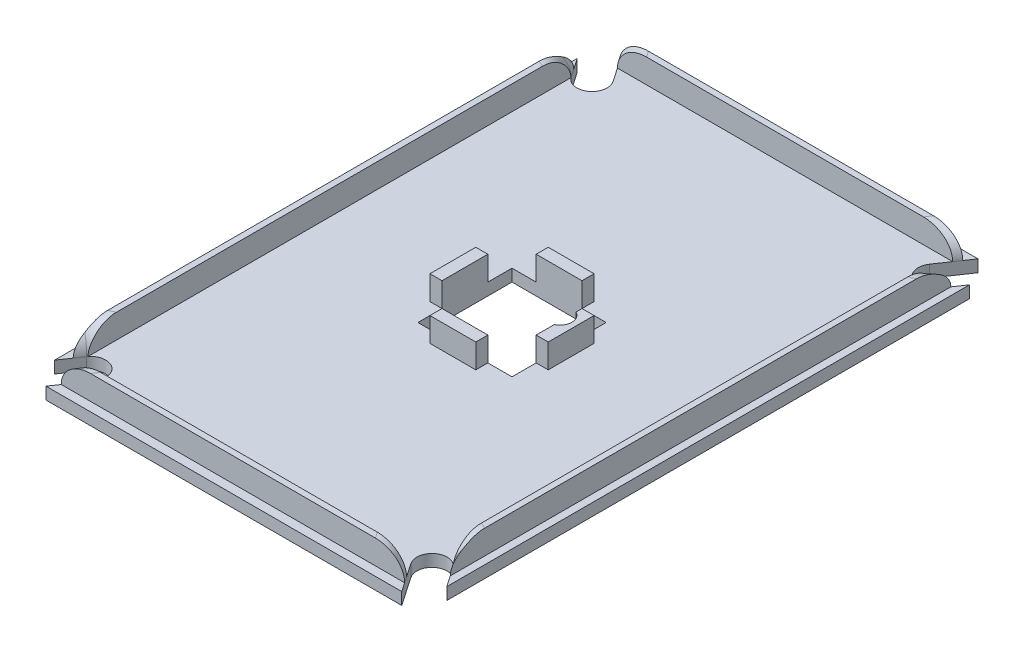
from build123d import *

# Parameters (mm, degrees)
SKETCH1_W           = 65
SKETCH1_H           = 95.5
BOSS_EXTRUDE1_DEPTH = 2
SKETCH1_3_W         = 62.5
SKETCH1_3_H         = 92.5
BOSS_EXTRUDE2_DEPTH = 6
SKETCH2_4_W         = 19.6
SKETCH2_4_H         = 19.6
BOSS_EXTRUDE3_DEPTH = 6
CUT_EXTRUDE2_DEPTH  = 39
CUT_EXTRUDE3_DEPTH  = 10
FILLET1_R           = 4
BOSS_EXTRUDE4_DEPTH = 1
SKETCH5_W           = 19.6
SKETCH5_H           = 19.6
CUT_EXTRUDE7_DEPTH  = 4
SKETCH8_W           = 6
SKETCH8_H           = 6
CUT_EXTRUDE8_DEPTH  = 10


with BuildPart() as part:
    # Sketch1 → Boss-Extrude1 (new body)
    with BuildSketch(Plane(origin=(0, 0, 0), x_dir=(1, 0, 0), z_dir=(0, 1, 0))):
        Rectangle(SKETCH1_W, SKETCH1_H)
    extrude(amount=BOSS_EXTRUDE1_DEPTH)

    # Sketch1<3> → Boss-Extrude2 (add)
    with BuildSketch(Plane(origin=(0, 0, 0), x_dir=(1, 0, 0), z_dir=(0, 1, 0))):
        Rectangle(SKETCH1_3_W, SKETCH1_3_H)
    extrude(amount=BOSS_EXTRUDE2_DEPTH)

    # Sketch2<4> → Boss-Extrude3 (add)
    with BuildSketch(Plane(origin=(0, 0, 0), x_dir=(1, 0, 0), z_dir=(0, 1, 0))):
        Rectangle(SKETCH2_4_W, SKETCH2_4_H)
    extrude(amount=BOSS_EXTRUDE3_DEPTH)

    # Sketch2 → Cut-Extrude2 (cut)
    with BuildSketch(Plane(origin=(0, 0, 0), x_dir=(1, 0, 0), z_dir=(0, 1, 0))):
        with BuildLine():
            Line((-7.8, 7.8), (-7.8, -7.8))
            Line((-7.8, -7.8), (7.8, -7.8))
            Line((7.8, -7.8), (7.8, -0.8))
            ThreePointArc((7.8, -0.8), (8.928220211, 1), (7.8, 2.8))
            Line((7.8, 2.8), (7.8, 7.8))
            Line((7.8, 7.8), (-7.8, 7.8))
        make_face()
    extrude(amount=CUT_EXTRUDE2_DEPTH, mode=Mode.SUBTRACT)

    # Sketch3 → Cut-Extrude3 (cut)
    with BuildSketch(Plane(origin=(0, 0, 0), x_dir=(1, 0, 0), z_dir=(0, 1, 0))):
        with BuildLine():
            Line((-30.433287704, 49.156662819), (-34.566712296, 46.343337181))
            Line((-34.566712296, 46.343337181), (-30.346723838, 40.143200294))
            ThreePointArc((-30.346723838, 40.143200294), (-26.873348724, 39.483150817), (-26.213299247, 42.956525932))
            Line((-26.213299247, 42.956525932), (-30.433287704, 49.156662819))
        make_face()
        with BuildLine():
            Line((34.566712296, 46.343337181), (30.433287704, 49.156662819))
            Line((30.433287704, 49.156662819), (26.213299247, 42.956525932))
            ThreePointArc((26.213299247, 42.956525932), (26.873348724, 39.483150817), (30.346723838, 40.143200294))
            Line((30.346723838, 40.143200294), (34.566712296, 46.343337181))
        make_face()
        with BuildLine():
            Line((-30.346723838, -40.143200294), (-34.566712296, -46.343337181))
            Line((-34.566712296, -46.343337181), (-30.433287704, -49.156662819))
            Line((-30.433287704, -49.156662819), (-26.213299247, -42.956525932))
            ThreePointArc((-26.213299247, -42.956525932), (-26.873348724, -39.483150817), (-30.346723838, -40.143200294))
        make_face()
        with BuildLine():
            Line((26.213299247, -42.956525932), (30.433287704, -49.156662819))
            Line((30.433287704, -49.156662819), (34.566712296, -46.343337181))
            Line((34.566712296, -46.343337181), (30.346723838, -40.143200294))
            ThreePointArc((30.346723838, -40.143200294), (26.873348724, -39.483150817), (26.213299247, -42.956525932))
        make_face()
    extrude(amount=CUT_EXTRUDE3_DEPTH, mode=Mode.SUBTRACT)

    # Fillet1
    # the kernel refuses this fillet: 4 mm, written as the material it takes off along each edge
    with BuildSketch(Plane(origin=(-36.876651276, 6, 49.737170606), x_dir=(0, -1, 0), z_dir=(0.5626651276372232, 0, -0.826684918297768)), Plane(origin=(30.346723838, 6, 40.143200294), x_dir=(0, -1, 0), z_dir=(0.5626651276372238, 0, 0.8266849182977677)), Plane(origin=(36.876651276, 6, -49.737170606), x_dir=(0, -1, 0), z_dir=(-0.562665127637224, 0, 0.8266849182977676)), Plane(origin=(-30.346723838, 6, -40.143200294), x_dir=(0, -1, 0), z_dir=(-0.5626651276372242, 0, -0.8266849182977674))) as fillet1_piece_1:
        with BuildLine():
            CenterArc((FILLET1_R, FILLET1_R), FILLET1_R, 180, 90)
            Line((0, FILLET1_R), (0, 0))
            Line((0, 0), (FILLET1_R, 0))
        make_face()
    extrude(amount=11.605353019, mode=Mode.SUBTRACT)
    with BuildSketch(Plane(origin=(-26.213299247, 6, 42.956525932), x_dir=(0, -1, 0), z_dir=(-0.5626651276372243, 0, 0.8266849182977672)), Plane(origin=(34.081582088, 6, 54.516849183), x_dir=(0, -1, 0), z_dir=(-0.5626651276372246, 0, -0.826684918297767)), Plane(origin=(26.213299247, 6, -42.956525932), x_dir=(0, -1, 0), z_dir=(0.5626651276372232, 0, -0.826684918297768)), Plane(origin=(-34.081582088, 6, -54.516849183), x_dir=(0, -1, 0), z_dir=(0.562665127637224, 0, 0.8266849182977676))) as fillet1_piece_2:
        with BuildLine():
            CenterArc((FILLET1_R, FILLET1_R), FILLET1_R, 180, 90)
            Line((0, FILLET1_R), (0, 0))
            Line((0, 0), (FILLET1_R, 0))
        make_face()
    extrude(amount=13.983953251, mode=Mode.SUBTRACT)
    with BuildSketch(Plane(origin=(-28.280011543, 6, 41.549863113), x_dir=(-0.8266849182977704, 0, -0.5626651276372198), z_dir=(-0.5626651276372198, 0, 0.8266849182977704))) as fillet1_piece_3:
        with BuildLine():
            CenterArc((2.5 + FILLET1_R, FILLET1_R), FILLET1_R, 180, 90)
            Line((2.5 + FILLET1_R, 0), (2.5, 0))
            Line((2.5, 0), (2.5, FILLET1_R))
        make_face()
    revolve(axis=Axis((-28.280011543, 6, 41.549863113), (0, -1, 0)), revolution_arc=180, mode=Mode.SUBTRACT)
    with BuildSketch(Plane(origin=(28.280011543, 6, 41.549863113), x_dir=(-0.8266849182977659, 0, 0.5626651276372262), z_dir=(0.5626651276372262, 0, 0.8266849182977659))) as fillet1_piece_4:
        with BuildLine():
            CenterArc((2.5 + FILLET1_R, FILLET1_R), FILLET1_R, 180, 90)
            Line((2.5 + FILLET1_R, 0), (2.5, 0))
            Line((2.5, 0), (2.5, FILLET1_R))
        make_face()
    revolve(axis=Axis((28.280011543, 6, 41.549863113), (0, -1, 0)), revolution_arc=180, mode=Mode.SUBTRACT)
    with BuildSketch(Plane(origin=(28.280011543, 6, -41.549863113), x_dir=(0.826684918297769, 0, 0.5626651276372218), z_dir=(0.5626651276372218, 0, -0.826684918297769))) as fillet1_piece_5:
        with BuildLine():
            CenterArc((2.5 + FILLET1_R, FILLET1_R), FILLET1_R, 180, 90)
            Line((2.5 + FILLET1_R, 0), (2.5, 0))
            Line((2.5, 0), (2.5, FILLET1_R))
        make_face()
    revolve(axis=Axis((28.280011543, 6, -41.549863113), (0, -1, 0)), revolution_arc=180, mode=Mode.SUBTRACT)
    with BuildSketch(Plane(origin=(-28.280011543, 6, -41.549863113), x_dir=(0.8266849182977655, 0, -0.562665127637227), z_dir=(-0.562665127637227, 0, -0.8266849182977655))) as fillet1_piece_6:
        with BuildLine():
            CenterArc((2.5 + FILLET1_R, FILLET1_R), FILLET1_R, 180, 90)
            Line((2.5 + FILLET1_R, 0), (2.5, 0))
            Line((2.5, 0), (2.5, FILLET1_R))
        make_face()
    revolve(axis=Axis((-28.280011543, 6, -41.549863113), (0, -1, 0)), revolution_arc=180, mode=Mode.SUBTRACT)

    # Sketch7 → Boss-Extrude4 (add)
    with BuildSketch(Plane(origin=(0, 0, 0), x_dir=(1, 0, 0), z_dir=(0, 1, 0))):
        with BuildLine():
            Line((7.8, 2.8), (7.8, -0.8))
            ThreePointArc((7.8, -0.8), (8.928220211, 1), (7.8, 2.8))
        make_face()
    extrude(amount=BOSS_EXTRUDE4_DEPTH)

    # Sketch5 → Cut-Extrude7 (cut)
    with BuildSketch(Plane(origin=(0, 6, 0), x_dir=(1, 0, 0), z_dir=(0, 1, 0))):
        Polygon((-21.756286609, -45.25), (21.756286609, -45.25), (30.25, -45.25), (30.25, -34.313210193), (30.25, 34.313210193), (30.25, 45.25), (21.756286609, 45.25), (-21.756286609, 45.25), (-30.25, 45.25), (-30.25, 34.313210193), (-30.25, -34.313210193), (-30.25, -45.25), align=None)
        Rectangle(SKETCH5_W, SKETCH5_H, mode=Mode.SUBTRACT)
    extrude(amount=-CUT_EXTRUDE7_DEPTH, mode=Mode.SUBTRACT)

    # Sketch8 → Cut-Extrude8 (cut)
    with BuildSketch(Plane(origin=(0, 2, 0), x_dir=(1, 0, 0), z_dir=(0, 1, 0))):
        with Locations((6.8, 6.8)):
            Rectangle(SKETCH8_W, SKETCH8_H)
        with Locations((-6.8, 6.8)):
            Rectangle(SKETCH8_W, SKETCH8_H)
        with Locations((-6.8, -6.8)):
            Rectangle(SKETCH8_W, SKETCH8_H)
        with Locations((6.8, -6.8)):
            Rectangle(SKETCH8_W, SKETCH8_H)
    extrude(amount=CUT_EXTRUDE8_DEPTH, mode=Mode.SUBTRACT)


solid = part.part
